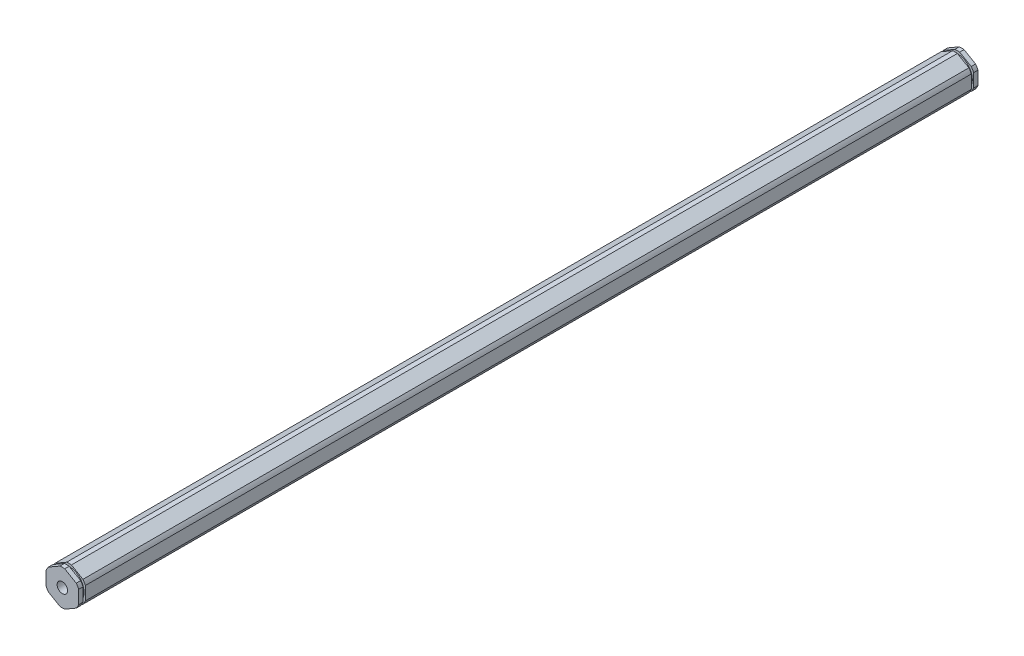
from build123d import *

# Parameters (mm, degrees)
BOSS_EXTRUDE1_DEPTH                  = 174.84725
F_10_32_TAPPED_HOLE1_D               = 4.0386
F_10_32_TAPPED_HOLE1_DEPTH           = 16.34744
F_10_32_TAPPED_HOLE1_TIP             = 1.213317848
F_10_32_TAPPED_HOLE1_ON_FACE_2_D     = 4.0386
F_10_32_TAPPED_HOLE1_ON_FACE_2_DEPTH = 16.34744
F_10_32_TAPPED_HOLE1_ON_FACE_2_TIP   = 1.213317848
SKETCH3_W                            = 0.889
SKETCH3_H                            = 1.0033


with BuildPart() as part:
    # Sketch1 → Boss-Extrude1 (new, symmetric)
    with BuildSketch(Plane.XY):
        with BuildLine():
            ThreePointArc((0.93173274, 6.79441227), (0, 6.858), (-0.93173274, 6.79441227))
            Line((-0.93173274, 6.79441227), (-5.41826726, 4.204110358))
            ThreePointArc((-5.41826726, 4.204110358), (-5.939202219, 3.429), (-6.35, 2.590301913))
            Line((-6.35, 2.590301913), (-6.35, -2.590301913))
            ThreePointArc((-6.35, -2.590301913), (-5.939202219, -3.429), (-5.41826726, -4.204110358))
            Line((-5.41826726, -4.204110358), (-0.93173274, -6.79441227))
            ThreePointArc((-0.93173274, -6.79441227), (0, -6.858), (0.93173274, -6.79441227))
            Line((0.93173274, -6.79441227), (5.41826726, -4.204110358))
            ThreePointArc((5.41826726, -4.204110358), (5.939202219, -3.429), (6.35, -2.590301913))
            Line((6.35, -2.590301913), (6.35, 2.590301913))
            ThreePointArc((6.35, 2.590301913), (5.939202219, 3.429), (5.41826726, 4.204110358))
            Line((5.41826726, 4.204110358), (0.93173274, 6.79441227))
        make_face()
    extrude(amount=BOSS_EXTRUDE1_DEPTH, both=True)

    # #10-32 Tapped Hole1
    with Locations(Plane.XY.offset(174.84725)):
        with Locations((0, 0)):
            Hole(F_10_32_TAPPED_HOLE1_D / 2, depth=F_10_32_TAPPED_HOLE1_DEPTH)
            with Locations((0, 0, -(F_10_32_TAPPED_HOLE1_DEPTH + F_10_32_TAPPED_HOLE1_TIP / 2))):  # 118° drill point
                Cone(0, F_10_32_TAPPED_HOLE1_D / 2, F_10_32_TAPPED_HOLE1_TIP, mode=Mode.SUBTRACT)

    # #10-32 Tapped Hole1 on face 2
    with Locations(Plane(origin=(0, 0, -174.84725), x_dir=(-1, 0, 0), z_dir=(0, 0, -1))):
        with Locations((0, 0)):
            Hole(F_10_32_TAPPED_HOLE1_ON_FACE_2_D / 2, depth=F_10_32_TAPPED_HOLE1_ON_FACE_2_DEPTH)
            with Locations((0, 0, -(F_10_32_TAPPED_HOLE1_ON_FACE_2_DEPTH + F_10_32_TAPPED_HOLE1_ON_FACE_2_TIP / 2))):  # 118° drill point
                Cone(0, F_10_32_TAPPED_HOLE1_ON_FACE_2_D / 2, F_10_32_TAPPED_HOLE1_ON_FACE_2_TIP, mode=Mode.SUBTRACT)

    # Sketch3 → Cut-Revolve1 (revolve, cut)
    with BuildSketch(Plane(origin=(0, 0, 0), x_dir=(0, 0, -1), z_dir=(1, 0, 0))):
        with Locations((-172.68825, 6.35635)):
            Rectangle(SKETCH3_W, SKETCH3_H)
    cut_revolve1 = revolve(axis=Axis((0, 0, 175.157387885), (0, 0, -1)), mode=Mode.SUBTRACT)

    # Mirror1: Cut-Revolve1 across plane
    add(cut_revolve1.mirror(Plane.XY), mode=Mode.SUBTRACT)


solid = part.part
